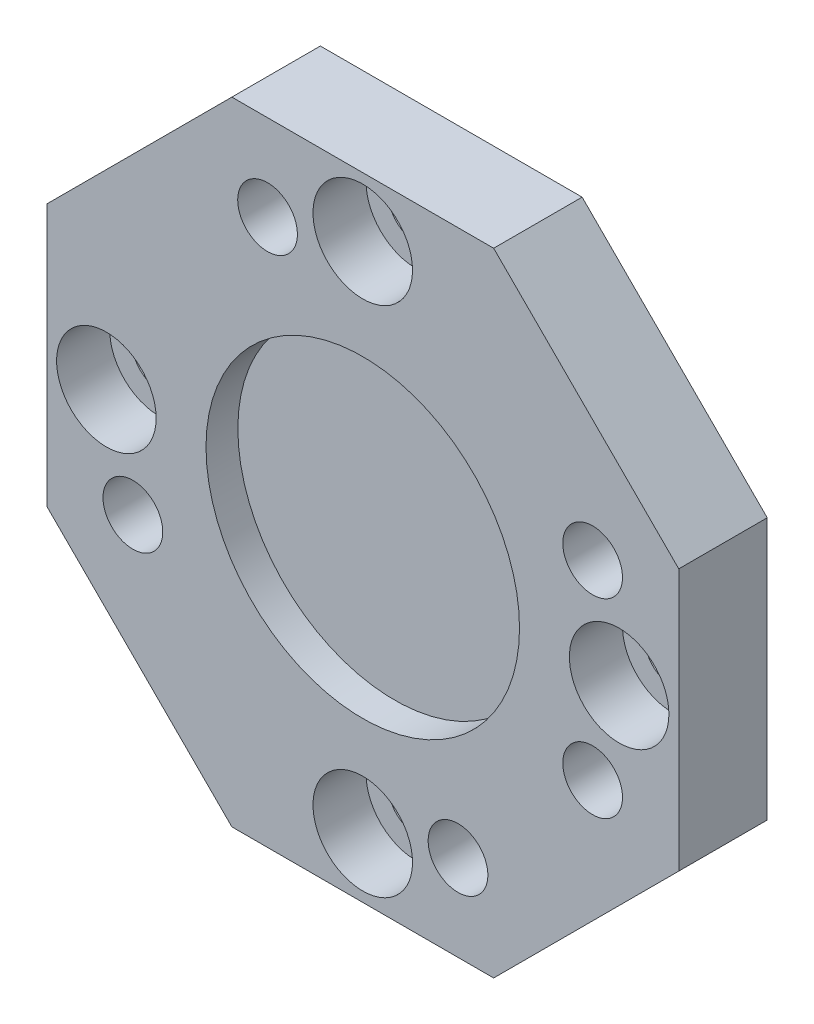
from build123d import *

# Parameters (mm, degrees)
BOSS_EXTRUDE1_DEPTH       = 8.89
SKETCH2_3_R               = 21.805
CUT_EXTRUDE1_DEPTH        = 3.2
ADVANCEDHOLE1_START       = 3.556
ADVANCEDHOLE1_OUTLINE_R   = 5
ADVANCEDHOLE1_DEPTH       = 5.334
ADVANCEDHOLE1_2_OUTLINE_R = 2.75
ADVANCEDHOLE1_2_DEPTH     = 3.556
SKETCH12_R                = 15.75
CUT_EXTRUDE2_DEPTH        = 3.2
ADVANCEDHOLE5_OUTLINE_R   = 3
ADVANCEDHOLE5_DEPTH       = 8.89
M6X1_0_TAPPED_HOLE1_D     = 6


# Read off the part's stored shape, not the designer's step: AdvancedHole1, AdvancedHole5
with BuildPart() as part:
    # Sketch2 → Boss-Extrude1 (new body)
    with BuildSketch(Plane.XY):
        Polygon((-13.151280605, 31.75), (-31.75, 13.151280605), (-31.75, -13.151280605), (-13.151280605, -31.75), (13.151280605, -31.75), (31.75, -13.151280605), (31.75, 13.151280605), (13.151280605, 31.75), align=None)
    extrude(amount=BOSS_EXTRUDE1_DEPTH)

    # Sketch2<3> → Cut-Extrude1 (cut)
    with BuildSketch(Plane.XY):
        Circle(SKETCH2_3_R)
    extrude(amount=CUT_EXTRUDE1_DEPTH, mode=Mode.SUBTRACT)

    # AdvancedHole1 outline → AdvancedHole1 (cut)
    with BuildSketch(Plane.XY.offset(ADVANCEDHOLE1_START)):
        with Locations((-25.76, 0)):
            Circle(ADVANCEDHOLE1_OUTLINE_R)
        with Locations((0, -25.76)):
            Circle(ADVANCEDHOLE1_OUTLINE_R)
        with Locations((25.76, 0)):
            Circle(ADVANCEDHOLE1_OUTLINE_R)
        with Locations((0, 25.76)):
            Circle(ADVANCEDHOLE1_OUTLINE_R)
    extrude(amount=ADVANCEDHOLE1_DEPTH, mode=Mode.SUBTRACT)

    # AdvancedHole1 2 outline → AdvancedHole1 2 (cut)
    with BuildSketch(Plane.XY):
        with Locations((-25.76, 0)):
            Circle(ADVANCEDHOLE1_2_OUTLINE_R)
        with Locations((0, -25.76)):
            Circle(ADVANCEDHOLE1_2_OUTLINE_R)
        with Locations((25.76, 0)):
            Circle(ADVANCEDHOLE1_2_OUTLINE_R)
        with Locations((0, 25.76)):
            Circle(ADVANCEDHOLE1_2_OUTLINE_R)
    extrude(amount=ADVANCEDHOLE1_2_DEPTH, mode=Mode.SUBTRACT)

    # Sketch12 → Cut-Extrude2 (cut)
    with BuildSketch(Plane.XY.offset(8.89)):
        Circle(SKETCH12_R)
    extrude(amount=-CUT_EXTRUDE2_DEPTH, mode=Mode.SUBTRACT)

    # AdvancedHole5 outline → AdvancedHole5 (cut)
    with BuildSketch(Plane.XY):
        with Locations((23.096988313, -9.567085809)):
            Circle(ADVANCEDHOLE5_OUTLINE_R)
    extrude(amount=ADVANCEDHOLE5_DEPTH, mode=Mode.SUBTRACT)

    # M6x1.0 Tapped Hole1 (through all)
    with Locations(Plane(origin=(-9.567085809, 23.096988313, 0), x_dir=(-1, 0, 0), z_dir=(0, 0, -1))):
        with Locations((0, 0), (-32.664074122, -13.529902504), (-19.134171618, -46.193976626), (13.529902504, -32.664074122)):
            Hole(M6X1_0_TAPPED_HOLE1_D / 2)


solid = part.part
